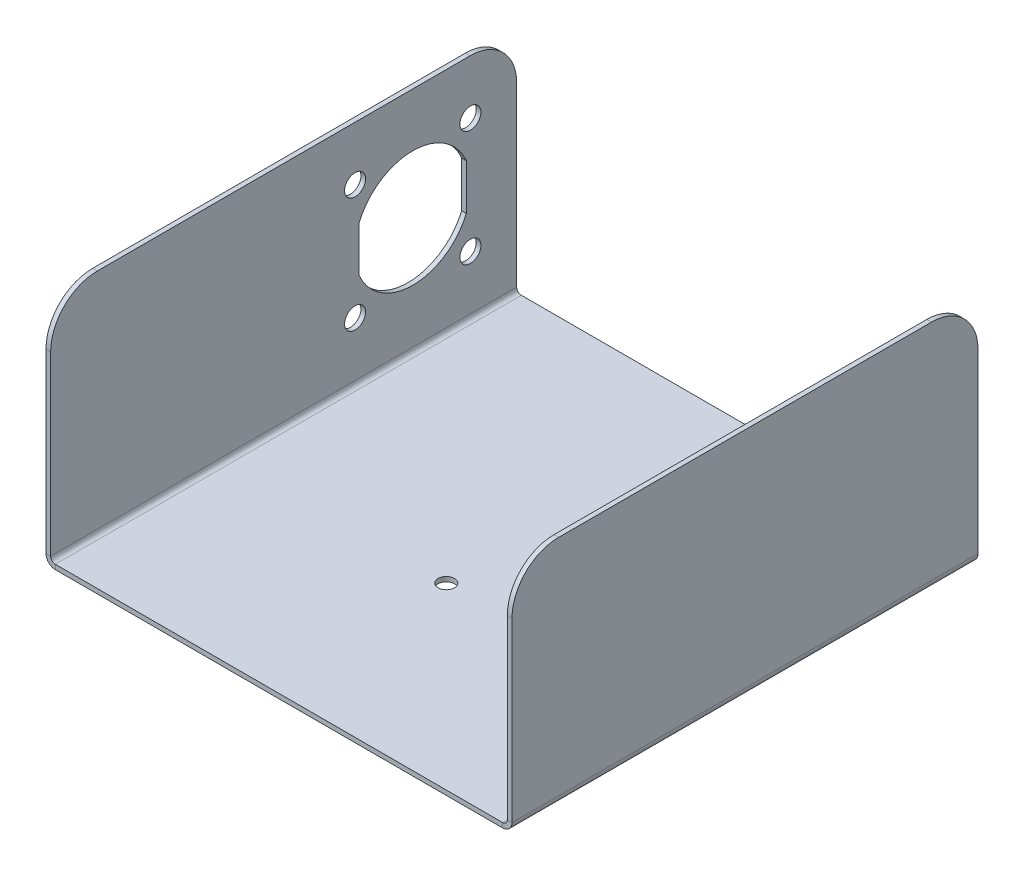
from build123d import *

# Parameters (mm, degrees)
SKETCH1_W                    = 100
SKETCH1_H                    = 100
BASE_FLANGE1_DEPTH           = 1
EDGE_FLANGE1_STRIP_W         = 6
EDGE_FLANGE1_STRIP_H         = 1
EDGE_FLANGE1_STRIP_CUT_DEPTH = 100
EDGE_FLANGE1_DEPTH           = 100
EDGE_FLANGE2_STRIP_W         = 6
EDGE_FLANGE2_STRIP_H         = 1
EDGE_FLANGE2_STRIP_CUT_DEPTH = 100
EDGE_FLANGE2_DEPTH           = 100
FILLET1_R                    = 10
SKETCH12_R                   = 2.25
CUT_EXTRUDE1_DEPTH           = 10
SKETCH13_R                   = 3.25
SKETCH13_R_2                 = 1.75
CUT_EXTRUDE2_DEPTH           = 8


# Sheet-metal steps are written as plain solids
with BuildPart() as part:
    # Sketch1 → Base-Flange1 (new body)
    with BuildSketch(Plane(origin=(0, 0, 0), x_dir=(1, 0, 0), z_dir=(0, 1, 0))):
        with Locations((50, 50)):
            Rectangle(SKETCH1_W, SKETCH1_H)
    extrude(amount=-BASE_FLANGE1_DEPTH)

    # Edge-Flange1 strip (across the edge) → Edge-Flange1 strip cut (cut)
    with BuildSketch(Plane(origin=(100, 0, 0), x_dir=(-1, 0, 0), z_dir=(0, 0, -1))):
        with Locations((-1, -0.5)):
            Rectangle(EDGE_FLANGE1_STRIP_W, EDGE_FLANGE1_STRIP_H)
    extrude(amount=EDGE_FLANGE1_STRIP_CUT_DEPTH, mode=Mode.SUBTRACT)

    # Edge-Flange1 section (across the edge) → Edge-Flange1 (add)
    with BuildSketch(Plane(origin=(100, 0, 0), x_dir=(-1, 0, 0), z_dir=(0, 0, -1))):
        with BuildLine():
            Line((0, 1), (0, 49))
            Line((0, 49), (1, 49))
            Line((1, 49), (1, 1))
            ThreePointArc((1, 1), (1.292893219, 0.292893219), (2, 0))
            Line((2, 0), (2, -1))
            ThreePointArc((2, -1), (0.585786438, -0.414213562), (0, 1))
        make_face()
    extrude(amount=EDGE_FLANGE1_DEPTH)

    # Edge-Flange2 strip (across the edge) → Edge-Flange2 strip cut (cut)
    with BuildSketch(Plane.XY.offset(-100)):
        with Locations((-1, -0.5)):
            Rectangle(EDGE_FLANGE2_STRIP_W, EDGE_FLANGE2_STRIP_H)
    extrude(amount=EDGE_FLANGE2_STRIP_CUT_DEPTH, mode=Mode.SUBTRACT)

    # Edge-Flange2 section (across the edge) → Edge-Flange2 (add)
    with BuildSketch(Plane.XY.offset(-100)):
        with BuildLine():
            Line((0, 1), (0, 49))
            Line((0, 49), (1, 49))
            Line((1, 49), (1, 1))
            ThreePointArc((1, 1), (1.292893219, 0.292893219), (2, 0))
            Line((2, 0), (2, -1))
            ThreePointArc((2, -1), (0.585786438, -0.414213562), (0, 1))
        make_face()
    extrude(amount=EDGE_FLANGE2_DEPTH)

    # Fillet1
    fillet1_edges = [part.edges().sort_by_distance(p)[0] for p in [
        (99.5, 49, 0),
        (99.5, 49, -100),
        (0.5, 49, -100),
        (0.5, 49, 0),
    ]]
    fillet(fillet1_edges, radius=FILLET1_R)

    # Sketch12 → Cut-Extrude1 (cut)
    with BuildSketch(Plane(origin=(-1, -31.373526732, -102.532454166), x_dir=(0, 0, 1), z_dir=(-1, 0, 0))):
        with BuildLine():
            ThreePointArc((36.332454166, 61.272506218), (24.832454166, 68.873526732), (13.332454166, 61.272506218))
            Line((13.332454166, 61.272506218), (13.332454166, 51.474547246))
            ThreePointArc((13.332454166, 51.474547246), (24.832454166, 43.873526732), (36.332454166, 51.474547246))
            Line((36.332454166, 51.474547246), (36.332454166, 61.272506218))
        make_face()
        with Locations(Location((12.458085495, 68.747895403, 0), (0, 0, 90))):
            Circle(SKETCH12_R)
        with Locations(Location((37.206822836, 68.747895403, 0), (0, 0, 90))):
            Circle(SKETCH12_R)
        with Locations(Location((37.206822836, 43.999158061, 0), (0, 0, 90))):
            Circle(SKETCH12_R)
        with Locations(Location((12.458085495, 43.999158061, 0), (0, 0, 90))):
            Circle(SKETCH12_R)
    extrude(amount=-CUT_EXTRUDE1_DEPTH, mode=Mode.SUBTRACT)

    # Sketch13 → Cut-Extrude2 (cut)
    with BuildSketch(Plane(origin=(17.313345769, -1, -102.532454166), x_dir=(1, 0, 0), z_dir=(0, -1, 0))):
        with Locations(Location((42.686654231, 56.832454166, 0), (0, 0, 270))):
            Circle(SKETCH13_R)
        with Locations(Location((30.129285876, 64.082454166, 0), (0, 0, 270))):
            Circle(SKETCH13_R_2)
        with Locations(Location((55.244022586, 64.082454166, 0), (0, 0, 270))):
            Circle(SKETCH13_R_2)
        with Locations(Location((42.686654231, 42.332454166, 0), (0, 0, 270))):
            Circle(SKETCH13_R_2)
    extrude(amount=-CUT_EXTRUDE2_DEPTH, mode=Mode.SUBTRACT)


solid = part.part
